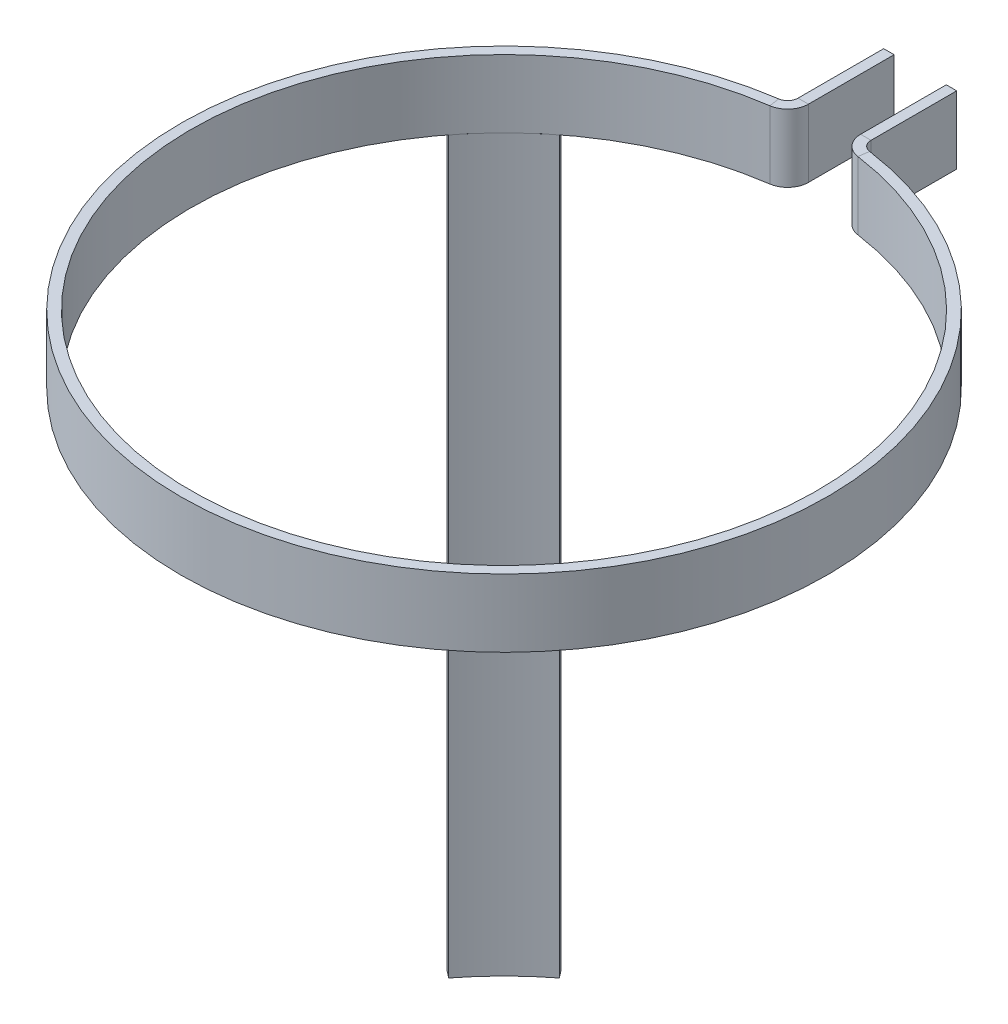
from build123d import *

# Parameters (mm, degrees)
BASE_FLANGE1_DEPTH = 8.255
BASE_FLANGE3_START = 88.9
BASE_FLANGE3_DEPTH = 88.9


# Read off the part's stored shape, not the designer's step: Base-Flange1
# Sheet-metal steps are written as plain solids
with BuildPart() as part:
    # Base-Flange1 outline → Base-Flange1 (new body)
    with BuildSketch(Plane(origin=(0, 0, 0), x_dir=(1, 0, 0), z_dir=(0, 1, 0))):
        with BuildLine():
            Line((-3.175, 40.236157558), (-3.175, 50.667477859))
            Line((-3.175, 50.667477859), (-4.445, 50.667477859))
            Line((-4.445, 50.667477859), (-4.445, 40.236157558))
            ThreePointArc((-4.445, 40.236157558), (-4.755908226, 39.403665534), (-5.53640625, 38.978777634))
            ThreePointArc((-5.53640625, 38.978777634), (0, -39.37), (5.53640625, 38.978777634))
            ThreePointArc((5.53640625, 38.978777634), (4.755908226, 39.403665534), (4.445, 40.236157558))
            Line((4.445, 40.236157558), (4.445, 50.667477859))
            Line((4.445, 50.667477859), (3.175, 50.667477859))
            Line((3.175, 50.667477859), (3.175, 40.236157558))
            ThreePointArc((3.175, 40.236157558), (3.796816452, 38.571173511), (5.3578125, 37.72139771))
            ThreePointArc((5.3578125, 37.72139771), (0, -38.1), (-5.3578125, 37.72139771))
            ThreePointArc((-5.3578125, 37.72139771), (-3.796816452, 38.571173511), (-3.175, 40.236157558))
        make_face()
    extrude(amount=BASE_FLANGE1_DEPTH)


with BuildPart() as body_2:
    # Sketch14 → Base-Flange3 (new body)
    with BuildSketch(Plane.XZ.offset(BASE_FLANGE3_START)):
        with BuildLine():
            Line((-24.140597875, -31.100296369), (-23.361868911, -30.097061002))
            ThreePointArc((-23.361868911, -30.097061002), (-26.940768363, -26.940768363), (-30.097061002, -23.361868911))
            Line((-30.097061002, -23.361868911), (-31.100296369, -24.140597875))
            ThreePointArc((-31.100296369, -24.140597875), (-27.838793975, -27.838793975), (-24.140597875, -31.100296369))
        make_face()
    extrude(amount=-BASE_FLANGE3_DEPTH)


solid = Compound([part.part, body_2.part])
